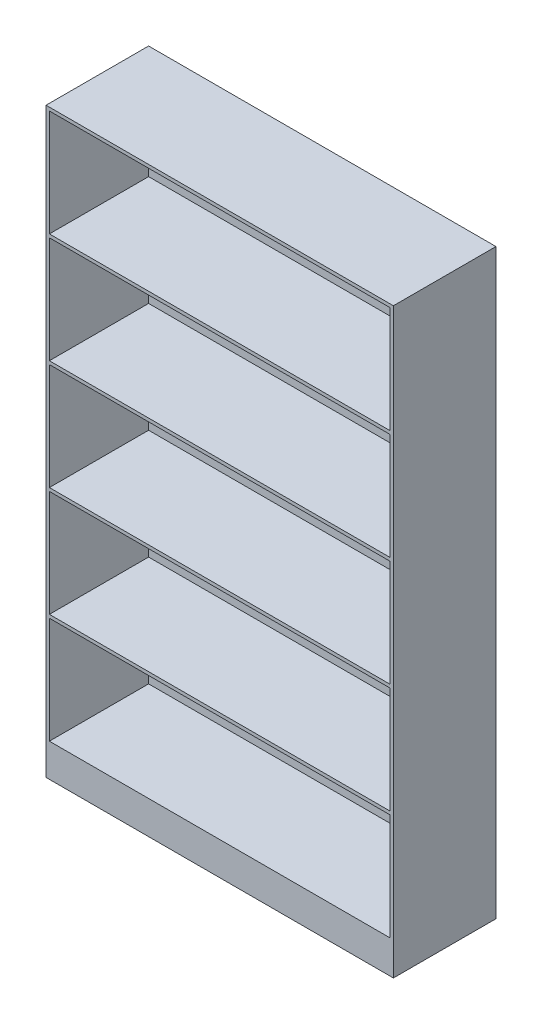
from build123d import *

# Parameters (mm, degrees)
CROQUIS1_W              = 1050
CROQUIS1_H              = 1760
SALIENTE_EXTRUIR1_DEPTH = 10
CROQUIS2_W              = 1050
CROQUIS2_H              = 1760
CROQUIS2_W_2            = 1030
CROQUIS2_H_2            = 322
SALIENTE_EXTRUIR2_DEPTH = 300


with BuildPart() as part:
    # Croquis1 → Saliente-Extruir1 (new body)
    with BuildSketch(Plane.XY):
        Rectangle(CROQUIS1_W, CROQUIS1_H)
    extrude(amount=SALIENTE_EXTRUIR1_DEPTH)

    # Croquis2 → Saliente-Extruir2 (add)
    with BuildSketch(Plane.XY.offset(10)):
        Rectangle(CROQUIS2_W, CROQUIS2_H)
        with Locations((0, 377)):
            Rectangle(CROQUIS2_W_2, CROQUIS2_H_2, mode=Mode.SUBTRACT)
        with Locations((0, 709)):
            Rectangle(CROQUIS2_W_2, CROQUIS2_H_2, mode=Mode.SUBTRACT)
        with Locations((0, 45)):
            Rectangle(CROQUIS2_W_2, CROQUIS2_H_2, mode=Mode.SUBTRACT)
        with Locations((0, -287)):
            Rectangle(CROQUIS2_W_2, CROQUIS2_H_2, mode=Mode.SUBTRACT)
        with Locations((0, -619)):
            Rectangle(CROQUIS2_W_2, CROQUIS2_H_2, mode=Mode.SUBTRACT)
    extrude(amount=SALIENTE_EXTRUIR2_DEPTH)


solid = part.part
